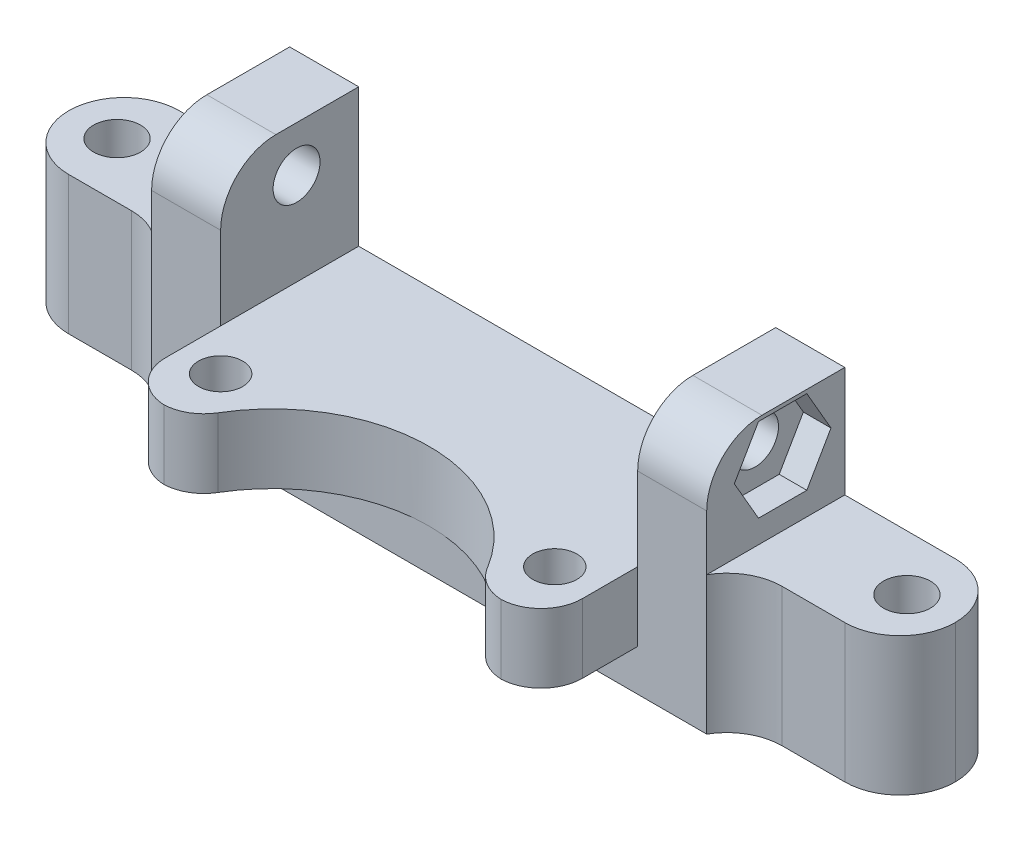
from build123d import *

# Parameters (mm, degrees)
BOSS_EXTRU_1_DEPTH           = 10
ESQUISSE2_W                  = 30.2
ESQUISSE2_H                  = 5
BOSS_EXTRU_2_DEPTH           = 9
ENL_V_MAT_EXTRU_1_DEPTH      = 47.925899032
ESQUISSE4_R                  = 1.6
ENL_V_MAT_EXTRU_2_DEPTH      = 47.925899032
ESQUISSE5_W                  = 30.2
ESQUISSE5_H                  = 2
ENL_V_MAT_EXTRU_3_DEPTH      = 47.925899032
CONG_2_R                     = 3
ESQUISSE6_W                  = 12
ESQUISSE6_H                  = 8
BOSS_EXTRU_3_DEPTH           = 10
ESQUISSE7_R                  = 1.7
ENL_V_MAT_EXTRU_4_DEPTH      = 58.773438571
CONG_3_R                     = 4
ENL_V_MAT_EXTRU_5_DEPTH      = 54.298876201
ENL_V_MAT_EXTRU_5_DEPTH_BACK = 54.298876201
ESQUISSE8_R                  = 1.7
ESQUISSE9_R                  = 3
ENL_V_MAT_EXTRU_6_DEPTH      = 2
ENL_V_MAT_EXTRU_7_DEPTH      = 2
CONG_4_R                     = 4
CONG_5_R                     = 4


# Some blends are built 0.0001 mm under size
with BuildPart() as part:
    # Esquisse1 → Boss.-Extru.1 (new body)
    with BuildSketch(Plane.XY):
        Polygon((-40.2, 0), (-35.2, 0), (-35.2, -10), (-5, -10), (-5, 0), (0, 0), (0, -18), (-40.2, -18), align=None)
    extrude(amount=BOSS_EXTRU_1_DEPTH)

    # Esquisse2 → Boss.-Extru.2 (add)
    with BuildSketch(Plane.XY.offset(10)):
        with Locations((-20.1, -12.5)):
            Rectangle(ESQUISSE2_W, ESQUISSE2_H)
    extrude(amount=BOSS_EXTRU_2_DEPTH)

    # Esquisse3 → Enlèv. mat.-Extru.1 (cut, through all)
    with BuildSketch(Plane.XZ.offset(15)):
        with BuildLine():
            Line((-31.2, 19), (-9, 19))
            ThreePointArc((-9, 19), (-20.1, 10), (-31.2, 19))
        make_face()
    extrude(amount=-ENL_V_MAT_EXTRU_1_DEPTH, mode=Mode.SUBTRACT)

    # Esquisse4 → Enlèv. mat.-Extru.2 (cut, through all)
    with BuildSketch(Plane.XZ.offset(15)):
        with Locations(Location((-32.2, 13, 0), (0, 0, 270))):
            Circle(ESQUISSE4_R)
        with Locations(Location((-8, 13, 0), (0, 0, 270))):
            Circle(ESQUISSE4_R)
    extrude(amount=-ENL_V_MAT_EXTRU_2_DEPTH, mode=Mode.SUBTRACT)

    # Esquisse5 → Enlèv. mat.-Extru.3 (cut, through all)
    with BuildSketch(Plane.XZ.offset(15)):
        with Locations((-20.1, 18)):
            Rectangle(ESQUISSE5_W, ESQUISSE5_H)
    extrude(amount=-ENL_V_MAT_EXTRU_3_DEPTH, mode=Mode.SUBTRACT)

    # Congé2
    # the kernel refuses this fillet: 3 mm, written as the material it takes off along each edge
    with BuildSketch(Plane(origin=(-5, -22.5, 17), x_dir=(0, 0, -1), z_dir=(0, 1, 0))) as cong_2_piece_1:
        with BuildLine():
            CenterArc((CONG_2_R, CONG_2_R), CONG_2_R, 180, 90)
            Line((0, CONG_2_R), (0, 0))
            Line((0, 0), (CONG_2_R, 0))
        make_face()
    extrude(amount=20, mode=Mode.SUBTRACT)
    with BuildSketch(Plane(origin=(-9.620019084, -5.395123123, 17), x_dir=(1, 0, 0), z_dir=(0, -1, 0))) as cong_2_piece_2:
        with BuildLine():
            CenterArc((1.841950751, -3), CONG_2_R, 90, 59.201185251)
            ThreePointArc((-0.734960717, -1.463924712), (-0.341024539, -0.745244452), (0, 0))
            Line((0, 0), (1.841950751, 0))
        make_face()
    extrude(amount=14.209753754, mode=Mode.SUBTRACT)
    with BuildSketch(Plane(origin=(-30.579980916, -5.395123123, 17), x_dir=(0.4486773426104955, 0, -0.8936938190610831), z_dir=(0, -1, 0))) as cong_2_piece_3:
        with BuildLine():
            CenterArc((1.854639889, -2.992172029), CONG_2_R, 94.139959503, 59.201185251)
            Line((-0.826441568, -1.646140001), (0, 0))
            ThreePointArc((0, 0), (0.819030344, -0.029602778), (1.638060688, 0))
        make_face()
    extrude(amount=14.209753754, mode=Mode.SUBTRACT)
    with BuildSketch(Plane(origin=(-35.2, -22.5, 17), x_dir=(0, 0, -1), z_dir=(0, 1, 0))) as cong_2_piece_4:
        with BuildLine():
            CenterArc((CONG_2_R, -CONG_2_R), CONG_2_R, 90, 90)
            Line((0, -CONG_2_R), (0, 0))
            Line((0, 0), (CONG_2_R, 0))
        make_face()
    extrude(amount=20, mode=Mode.SUBTRACT)

    # Esquisse6 → Boss.-Extru.3 (add)
    with BuildSketch(Plane.XZ.offset(18)):
        with Locations((-46.2, 4)):
            Rectangle(ESQUISSE6_W, ESQUISSE6_H)
        with Locations((6, 4)):
            Rectangle(ESQUISSE6_W, ESQUISSE6_H)
    extrude(amount=-BOSS_EXTRU_3_DEPTH)

    # Esquisse7 → Enlèv. mat.-Extru.4 (cut, through all)
    with BuildSketch(Plane.XZ.offset(18)):
        with Locations((-48.7, 4)):
            Circle(ESQUISSE7_R)
        with Locations((8.5, 4)):
            Circle(ESQUISSE7_R)
    extrude(amount=-ENL_V_MAT_EXTRU_4_DEPTH, mode=Mode.SUBTRACT)

    # Congé3
    cong_3_edges = [part.edges().sort_by_distance(p)[0] for p in [
        (-52.2, -13, 8),
        (-52.2, -13, 0),
        (12, -13, 0),
        (12, -13, 8),
    ]]
    fillet(cong_3_edges, radius=CONG_3_R - 0.0001)  # a hair under: the kernel refuses the full size

    # Esquisse8 → Enlèv. mat.-Extru.5 (cut, two sides: drawn at the far end of the back side and taken through both)
    with BuildSketch(Plane.ZY.offset(5).offset(-ENL_V_MAT_EXTRU_5_DEPTH_BACK)):
        with Locations((4.5, -3.3)):
            Circle(ESQUISSE8_R)
    extrude(amount=ENL_V_MAT_EXTRU_5_DEPTH + ENL_V_MAT_EXTRU_5_DEPTH_BACK, mode=Mode.SUBTRACT)

    # Esquisse9 → Enlèv. mat.-Extru.6 (cut)
    with BuildSketch(Plane.ZY.offset(40.2)):
        with Locations((4.5, -3.3)):
            Circle(ESQUISSE9_R)
    extrude(amount=-ENL_V_MAT_EXTRU_6_DEPTH, mode=Mode.SUBTRACT)

    # Esquisse10 → Enlèv. mat.-Extru.7 (cut)
    with BuildSketch(Plane(origin=(0, 0, 0), x_dir=(0, 0, -1), z_dir=(1, 0, 0))):
        Polygon((-8, -3.3), (-6.25, -6.331088913), (-2.75, -6.331088913), (-1, -3.3), (-2.75, -0.268911087), (-6.25, -0.268911087), align=None)
    extrude(amount=-ENL_V_MAT_EXTRU_7_DEPTH, mode=Mode.SUBTRACT)

    # Congé4
    cong_4_edges = [part.edges().sort_by_distance(p)[0] for p in [
        (-2.5, 0, 10),
        (-37.7, 0, 10),
    ]]
    fillet(cong_4_edges, radius=CONG_4_R)

    # Congé5
    # the kernel refuses this fillet: 4 mm, written as the material it adds along each edge
    with BuildSketch(Plane(origin=(0, -18, 8), x_dir=(0, 0, 1), z_dir=(0, 1, 0))) as cong_5_piece_1:
        with BuildLine():
            CenterArc((4, 3.464101615), CONG_5_R, 180, 60)
            Line((0, 3.464101615), (0, 0))
            Line((0, 0), (2, 0))
        make_face()
    extrude(amount=10)
    with BuildSketch(Plane(origin=(-40.2, -18, 8), x_dir=(0, 0, 1), z_dir=(0, 1, 0))) as cong_5_piece_2:
        with BuildLine():
            CenterArc((4, -3.464101615), CONG_5_R, 120, 60)
            Line((0, -3.464101615), (0, 0))
            Line((0, 0), (2, 0))
        make_face()
    extrude(amount=10)


solid = part.part
